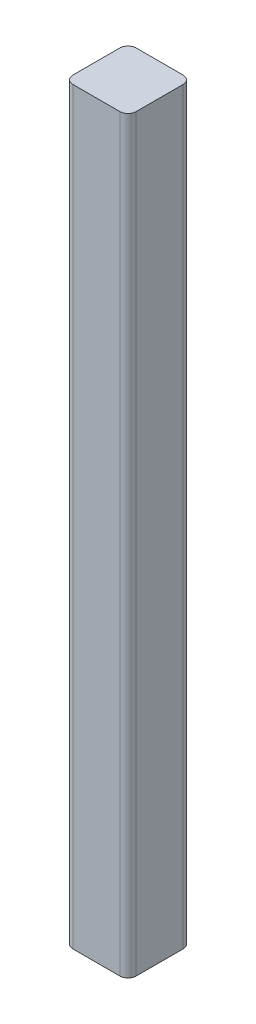
from build123d import *

# Parameters (mm, degrees)
EXTRUDE_2_DEPTH = 83


with BuildPart() as part:
    # 草图1 → 凸台-拉伸2 (new body)
    with BuildSketch(Plane(origin=(0, 0, 0), x_dir=(1, 0, 0), z_dir=(0, 1, 0))):
        with BuildLine():
            Line((-2.605000124, 3.505000102), (2.605000124, 3.505000102))
            ThreePointArc((2.605000124, 3.505000102), (3.241396212, 3.241396212), (3.505000102, 2.605000124))
            Line((3.505000102, 2.605000124), (3.505000102, -2.605000124))
            ThreePointArc((3.505000102, -2.605000124), (3.241396212, -3.241396212), (2.605000124, -3.505000102))
            Line((2.605000124, -3.505000102), (-2.605000124, -3.505000102))
            ThreePointArc((-2.605000124, -3.505000102), (-3.241396212, -3.241396212), (-3.505000102, -2.605000124))
            Line((-3.505000102, -2.605000124), (-3.505000102, 2.605000124))
            ThreePointArc((-3.505000102, 2.605000124), (-3.241396212, 3.241396212), (-2.605000124, 3.505000102))
        make_face()
    extrude(amount=EXTRUDE_2_DEPTH)


solid = part.part
